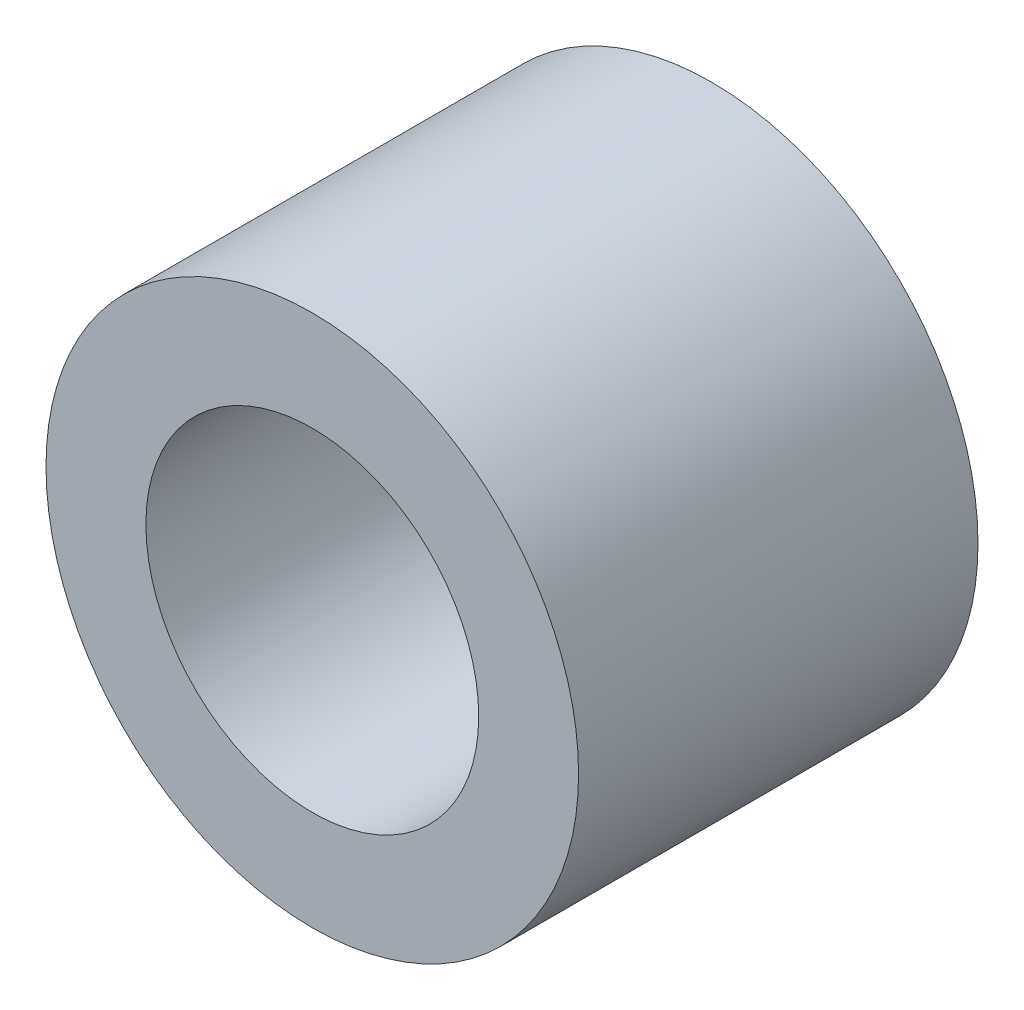
from build123d import *

# Parameters (mm, degrees)
SKETCH1_R           = 6.35
SKETCH1_R_2         = 3.96875
BOSS_EXTRUDE1_DEPTH = 9.525


with BuildPart() as part:
    # Sketch1 → Boss-Extrude1 (new body)
    with BuildSketch(Plane.XY):
        Circle(SKETCH1_R)
        Circle(SKETCH1_R_2, mode=Mode.SUBTRACT)
    extrude(amount=BOSS_EXTRUDE1_DEPTH)


solid = part.part
